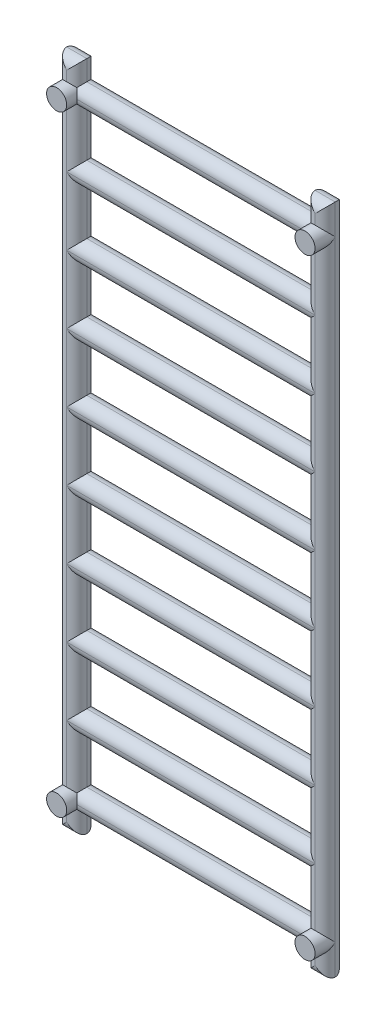
from build123d import *

# Parameters (mm, degrees)
SKETCH_2_W             = 30
SKETCH_2_H             = 30
EXTRUDE_1_DEPTH        = 1000
EXTRUDE_1_2_DEPTH      = 1000
SKETCH_3_W             = 30
SKETCH_3_H             = 30
EXTRUDE_2_DEPTH        = 340
PATTERN_LINEAR_1_COUNT = 10
PATTERN_LINEAR_1_PITCH = 101.111111111
FILLET_1_R             = 15
SKETCH_4_R             = 15
EXTRUDE_3_DEPTH        = 30


with BuildPart() as part:
    # Эскиз2 → Бобышка-Вытянуть1 (new body)
    with BuildSketch(Plane(origin=(0, 0, 0), x_dir=(1, 0, 0), z_dir=(0, 1, 0))):
        Rectangle(SKETCH_2_W, SKETCH_2_H)
    extrude(amount=EXTRUDE_1_DEPTH)



with BuildPart() as body_2:
    # Эскиз2 → Extrude 1 2 (new body)
    with BuildSketch(Plane(origin=(0, 0, 0), x_dir=(1, 0, 0), z_dir=(0, 1, 0))):
        with Locations((370, 0)):
            Rectangle(SKETCH_2_W, SKETCH_2_H)
    extrude(amount=EXTRUDE_1_2_DEPTH)


with BuildPart() as part_1:
    add(part.part)

    add(body_2.part)  # Бобышка-Вытянуть2 merges body 2
    # Эскиз3 → Бобышка-Вытянуть2 (add)
    with BuildSketch(Plane(origin=(15, 0, 0), x_dir=(0, 0, -1), z_dir=(1, 0, 0))):
        with Locations((0, 45)):
            Rectangle(SKETCH_3_W, SKETCH_3_H)
    extrude_2 = extrude(amount=EXTRUDE_2_DEPTH)

    # Линейный массив1: Бобышка-Вытянуть2 ×10
    with Locations(*[(0, i * PATTERN_LINEAR_1_PITCH, 0) for i in range(1, PATTERN_LINEAR_1_COUNT)]):
        add(extrude_2)

    # Скругление1
    fillet_1_edges = [part_1.edges().sort_by_distance(p)[0] for p in [
        (355, 95.555555556, -15),
        (185, 60, -15),
        (15, 95.555555556, -15),
        (185, 131.111111111, 15),
        (185, 131.111111111, -15),
        (355, 196.666666667, -15),
        (185, 161.111111111, -15),
        (185, 161.111111111, 15),
        (15, 196.666666667, -15),
        (185, 232.222222222, 15),
        (185, 232.222222222, -15),
        (355, 297.777777778, -15),
        (185, 262.222222222, -15),
        (185, 262.222222222, 15),
        (15, 297.777777778, -15),
        (185, 333.333333333, 15),
        (185, 333.333333333, -15),
        (355, 398.888888889, -15),
        (185, 363.333333333, -15),
        (185, 363.333333333, 15),
        (15, 398.888888889, -15),
        (185, 434.444444444, 15),
        (185, 434.444444444, -15),
        (355, 500, -15),
        (185, 464.444444444, -15),
        (185, 464.444444444, 15),
        (15, 500, -15),
        (185, 535.555555556, 15),
        (185, 535.555555556, -15),
        (355, 601.111111111, -15),
        (185, 565.555555556, -15),
        (185, 565.555555556, 15),
        (15, 601.111111111, -15),
        (185, 636.666666667, 15),
        (185, 636.666666667, -15),
        (355, 702.222222222, -15),
        (185, 666.666666667, -15),
        (185, 666.666666667, 15),
        (15, 702.222222222, -15),
        (185, 737.777777778, 15),
        (185, 737.777777778, -15),
        (355, 803.333333333, -15),
        (185, 767.777777778, -15),
        (185, 767.777777778, 15),
        (15, 803.333333333, -15),
        (185, 838.888888889, 15),
        (185, 838.888888889, -15),
        (355, 904.444444444, -15),
        (185, 868.888888889, -15),
        (185, 868.888888889, 15),
        (15, 904.444444444, -15),
        (185, 940, 15),
        (185, 940, -15),
        (0, 1000, -15),
        (-15, 500, -15),
        (0, 0, -15),
        (15, 15, -15),
        (185, 30, -15),
        (355, 15, -15),
        (370, 0, -15),
        (385, 500, -15),
        (370, 1000, -15),
        (355, 985, -15),
        (185, 970, -15),
        (185, 970, 15),
        (15, 985, -15),
        (-15, 500, 15),
        (0, 1000, 15),
        (15, 985, 15),
        (355, 985, 15),
        (370, 1000, 15),
        (385, 500, 15),
        (370, 0, 15),
        (355, 15, 15),
        (185, 30, 15),
        (15, 15, 15),
        (0, 0, 15),
        (185, 60, 15),
        (355, 95.555555556, 15),
        (15, 95.555555556, 15),
        (355, 196.666666667, 15),
        (15, 196.666666667, 15),
        (355, 297.777777778, 15),
        (15, 297.777777778, 15),
        (355, 398.888888889, 15),
        (15, 398.888888889, 15),
        (355, 500, 15),
        (15, 500, 15),
        (355, 601.111111111, 15),
        (15, 601.111111111, 15),
        (355, 702.222222222, 15),
        (15, 702.222222222, 15),
        (355, 803.333333333, 15),
        (15, 803.333333333, 15),
        (355, 904.444444444, 15),
        (15, 904.444444444, 15),
    ]]
    fillet(fillet_1_edges, radius=FILLET_1_R - 0.0001)  # a hair under: the kernel refuses the full size

    # Эскиз4 → Бобышка-Вытянуть3 (add)
    with BuildSketch(Plane.XY):
        with Locations((0, 955)):
            Circle(SKETCH_4_R)
        with Locations((370, 955)):
            Circle(SKETCH_4_R)
        with Locations((370, 45)):
            Circle(SKETCH_4_R)
        with Locations((0, 45)):
            Circle(SKETCH_4_R)
    extrude(amount=EXTRUDE_3_DEPTH)


solid = part_1.part
